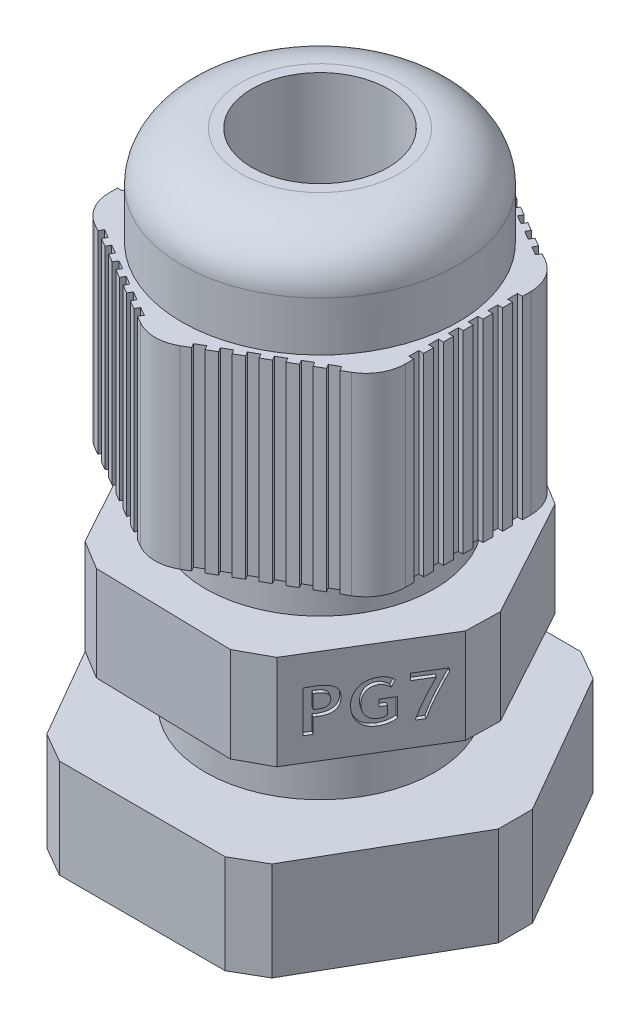
from build123d import *

# Parameters (mm, degrees)
SKETCH1_R           = 5.8
BOSS_EXTRUDE1_DEPTH = 8.25
BOSS_EXTRUDE2_DEPTH = 4.8
SKETCH3_R           = 5.8
BOSS_EXTRUDE3_DEPTH = 2.5
BOSS_EXTRUDE4_DEPTH = 9.8
CHAMFER1_SIZE       = 1
FILLET1_R           = 2
SKETCH5_R           = 7
BOSS_EXTRUDE5_DEPTH = 5
FILLET2_SIZE        = 2.5
FILLET2_SIZE_2      = 3
SKETCH6_R           = 3.45
CUT_EXTRUDE1_DEPTH  = 30.35
CUT_EXTRUDE2_DEPTH  = 0.2
SKETCH8_W           = 0.5
SKETCH8_H           = 9.8
CUT_EXTRUDE3_DEPTH  = 0.25
SKETCH10_R          = 5.8
BOSS_EXTRUDE7_DEPTH = 5
CIRPATTERN1_COUNT   = 6
CIRPATTERN2_COUNT   = 3


with BuildPart() as part:
    # Sketch1 → Boss-Extrude1 (new body)
    with BuildSketch(Plane(origin=(0, 0, 0), x_dir=(1, 0, 0), z_dir=(0, 1, 0))):
        with Locations(Location((0, 0, 0), (0, 0, 270))):
            Circle(SKETCH1_R)
    extrude(amount=BOSS_EXTRUDE1_DEPTH)

    # Sketch2 → Boss-Extrude2 (add)
    with BuildSketch(Plane(origin=(0, 8.25, 0), x_dir=(1, 0, 0), z_dir=(0, 1, 0))):
        Polygon((8.946496097, -0.208664632), (4.65395692, 7.643560578), (-4.292539176, 7.85222521), (-8.946496097, 0.208664632), (-4.65395692, -7.643560578), (4.292539176, -7.85222521), align=None)
    extrude(amount=BOSS_EXTRUDE2_DEPTH)

    # Sketch3 → Boss-Extrude3 (add)
    with BuildSketch(Plane(origin=(0, 13.05, 0), x_dir=(1, 0, 0), z_dir=(0, 1, 0))):
        with Locations(Location((0, 0, 0), (0, 0, 270))):
            Circle(SKETCH3_R)
    extrude(amount=BOSS_EXTRUDE3_DEPTH)

    # Sketch4 → Boss-Extrude4 (add)
    with BuildSketch(Plane(origin=(0, 15.55, 0), x_dir=(1, 0, 0), z_dir=(0, 1, 0))):
        Polygon((7.5, 4.330127019), (0, 8.660254038), (-7.5, 4.330127019), (-7.5, -4.330127019), (0, -8.660254038), (7.5, -4.330127019), align=None)
    extrude(amount=BOSS_EXTRUDE4_DEPTH)

    # Chamfer1
    chamfer1_edges = [part.edges().sort_by_distance(p)[0] for p in [
        (4.292539176, 10.65, 7.85222521),
        (8.946496097, 10.65, 0.208664632),
        (4.65395692, 10.65, -7.643560578),
        (-4.292539176, 10.65, -7.85222521),
        (-8.946496097, 10.65, -0.208664632),
        (-4.65395692, 10.65, 7.643560578),
    ]]
    chamfer(chamfer1_edges, length=CHAMFER1_SIZE)

    # Fillet1
    fillet1_edges = [part.edges().sort_by_distance(p)[0] for p in [
        (7.5, 20.45, 4.330127019),
        (7.5, 20.45, -4.330127019),
        (0, 20.45, -8.660254038),
        (-7.5, 20.45, -4.330127019),
        (-7.5, 20.45, 4.330127019),
        (0, 20.45, 8.660254038),
    ]]
    fillet(fillet1_edges, radius=FILLET1_R)

    # Sketch5 → Boss-Extrude5 (add)
    with BuildSketch(Plane(origin=(0, 25.35, 0), x_dir=(1, 0, 0), z_dir=(0, 1, 0))):
        with Locations(Location((0, 0, 0), (0, 0, 270))):
            Circle(SKETCH5_R)
    extrude(amount=BOSS_EXTRUDE5_DEPTH)

    # Fillet2
    # an asymmetric fillet: 3, 2.5 mm, written as the material it takes off along each edge
    with BuildSketch(Plane(origin=(0, 30.35, 0), x_dir=(0, 0, 1), z_dir=(-1, 0, 0))) as fillet2_piece_1:
        with BuildLine():
            Bezier((7, -FILLET2_SIZE), (7, 0), (7 - FILLET2_SIZE_2, 0), weights=[1, 0.707106781, 1])
            Line((7 - FILLET2_SIZE_2, 0), (7, 0))
            Line((7, 0), (7, -FILLET2_SIZE))
        make_face()
    revolve(axis=Axis((0, 30.35, 0), (0, 1, 0)), mode=Mode.SUBTRACT)

    # Sketch6 → Cut-Extrude1 (cut)
    with BuildSketch(Plane(origin=(0, 30.35, 0), x_dir=(1, 0, 0), z_dir=(0, 1, 0))):
        with Locations(Location((0, 0, 0), (0, 0, 270))):
            Circle(SKETCH6_R)
    extrude(amount=-CUT_EXTRUDE1_DEPTH, mode=Mode.SUBTRACT)

    # Sketch7 → Cut-Extrude2 (cut)
    # profile 1 of 3: a face of its own
    with BuildSketch(Plane(origin=(-6.800226508, 0, 3.717447973), x_dir=(0.4796707062222577, 0, 0.8774485817369816), z_dir=(-0.8774485817369816, 0, 0.4796707062222577))):
        with BuildLine():
            Line((-2.134885405, 10.216379947), (-2.134885405, 9.45))
            Line((-2.134885405, 9.45), (-2.513219528, 9.45))
            Line((-2.513219528, 9.45), (-2.513219528, 11.542238367))
            add(Edge.make_bspline(
                [(-2.513219528, 11.542238367), (-2.483523913, 11.543567356), (-2.427375364, 11.546080213), (-2.347967637, 11.548688603), (-2.27846118, 11.551957657), (-2.218632578, 11.553974035), (-2.168665192, 11.555578539), (-2.128279385, 11.557149828), (-2.097725351, 11.557314508), (-2.08055587, 11.55770478), (-2.073659459, 11.55786154)],
                knots=[0, 0, 0, 0, 1.621915894, 3.06672294, 4.33503342, 5.418568965, 6.332983946, 7.062930741, 7.623610357, 8, 8, 8, 8], degree=3))
            add(Edge.make_bspline(
                [(-2.073659459, 11.55786154), (-2.033253135, 11.557378437), (-1.95518837, 11.556445087), (-1.842316581, 11.549232733), (-1.737858336, 11.537617628), (-1.641731769, 11.521448641), (-1.553863318, 11.500074815), (-1.474521723, 11.473564124), (-1.403211823, 11.442992506), (-1.340418447, 11.406840154), (-1.285417521, 11.365570046), (-1.237401277, 11.319382527), (-1.197617084, 11.26710511), (-1.163991949, 11.210101824), (-1.138970637, 11.147036902), (-1.12063961, 11.078922791), (-1.110248523, 11.005456847), (-1.108749639, 10.954782697), (-1.107978502, 10.928712162)],
                knots=[0, 0, 0, 0, 1.477239666, 2.854017795, 4.133233606, 5.318502461, 6.415589596, 7.435923392, 8.373832858, 9.247662204, 10.078235651, 10.882486382, 11.675045235, 12.472932273, 13.294755343, 14.147339862, 15.04685446, 16, 16, 16, 16], degree=3))
            add(Edge.make_bspline(
                [(-1.107978502, 10.928712162), (-1.108573533, 10.899542636), (-1.109730059, 10.842847635), (-1.120185701, 10.760787184), (-1.13618153, 10.684080634), (-1.160129653, 10.61328312), (-1.189904379, 10.547710765), (-1.227062562, 10.488065605), (-1.270707731, 10.4339653), (-1.321709039, 10.385985109), (-1.378896899, 10.343043645), (-1.443115023, 10.306352429), (-1.513823244, 10.275484008), (-1.591060478, 10.250283457), (-1.674939167, 10.230432462), (-1.765622391, 10.216886085), (-1.86293348, 10.208306115), (-1.930076108, 10.207225702), (-1.9647195, 10.206668245)],
                knots=[0, 0, 0, 0, 1.091067431, 2.120640177, 3.090684274, 4.018396006, 4.911555342, 5.779703764, 6.64093865, 7.505260178, 8.393264397, 9.311130961, 10.266246865, 11.27557445, 12.347403441, 13.487847833, 14.703811947, 16, 16, 16, 16], degree=3))
            add(Edge.make_bspline(
                [(-1.9647195, 10.206668245), (-1.976123556, 10.206701924), (-2.000920231, 10.206775155), (-2.040735846, 10.209336139), (-2.086082113, 10.21207232), (-2.118001293, 10.214889669), (-2.134885405, 10.216379947)],
                knots=[0, 0, 0, 0, 0.802473668, 1.744877334, 2.807120216, 4, 4, 4, 4], degree=3))
        make_face()
        with BuildLine():
            Line((-2.134885405, 11.226396934), (-2.134885405, 10.541088585))
            add(Edge.make_bspline(
                [(-2.134885405, 10.541088585), (-2.119684957, 10.539683417), (-2.091123571, 10.53704313), (-2.050769504, 10.53327857), (-2.015540106, 10.531766425), (-1.993714297, 10.531209597), (-1.983720656, 10.530954636)],
                knots=[0, 0, 0, 0, 1.208754047, 2.271228472, 3.208426916, 4, 4, 4, 4], degree=3))
            add(Edge.make_bspline(
                [(-1.983720656, 10.530954636), (-1.962880278, 10.531135836), (-1.922560705, 10.531486401), (-1.864374221, 10.535910165), (-1.810433828, 10.542296714), (-1.761048697, 10.552316235), (-1.715568643, 10.563521662), (-1.674842164, 10.578994779), (-1.638315092, 10.596684303), (-1.605589771, 10.616857511), (-1.577622667, 10.641052235), (-1.552489017, 10.66758982), (-1.53250897, 10.698541535), (-1.51519604, 10.732191227), (-1.50224623, 10.769609665), (-1.493254671, 10.810290418), (-1.486924704, 10.854201041), (-1.486521703, 10.884633205), (-1.486312624, 10.900421552)],
                knots=[0, 0, 0, 0, 1.403595211, 2.715515055, 3.929222961, 5.059826169, 6.108541088, 7.08069188, 7.988175292, 8.840483437, 9.661193659, 10.47314836, 11.293639464, 12.13324769, 13.017905562, 13.951754922, 14.937360934, 16, 16, 16, 16], degree=3))
            add(Edge.make_bspline(
                [(-1.486312624, 10.900421552), (-1.48667261, 10.913965119), (-1.487370582, 10.940224546), (-1.494066128, 10.978134579), (-1.503859402, 11.013686705), (-1.519019714, 11.04628161), (-1.537603358, 11.076815354), (-1.561032375, 11.104213439), (-1.588583551, 11.128943766), (-1.619855059, 11.151475598), (-1.655744825, 11.170803974), (-1.695521578, 11.187589522), (-1.739433227, 11.201996391), (-1.787421917, 11.213745397), (-1.83983467, 11.222321087), (-1.896158474, 11.229216183), (-1.956789048, 11.23286888), (-1.99849506, 11.23333462), (-2.020033975, 11.233575149)],
                knots=[0, 0, 0, 0, 0.913750955, 1.771658647, 2.592923553, 3.396899075, 4.190866566, 5.000218413, 5.821208234, 6.686404457, 7.596737657, 8.567773798, 9.598787233, 10.714604217, 11.900680618, 13.183445848, 14.545401084, 16, 16, 16, 16], degree=3))
            add(Edge.make_bspline(
                [(-2.020033975, 11.233575149), (-2.0394783, 11.233344616), (-2.077884026, 11.232889277), (-2.116044894, 11.228542831), (-2.134885405, 11.226396934)],
                knots=[0, 0, 0, 0, 1.012574262, 2, 2, 2, 2], degree=3))
        make_face(mode=Mode.SUBTRACT)
    # profile 2 of 3: a face of its own
    with BuildSketch(Plane(origin=(-6.800226508, 0, 3.717447973), x_dir=(0.4796707062222577, 0, 0.8774485817369816), z_dir=(-0.8774485817369816, 0, 0.4796707062222577))):
        with BuildLine():
            Line((0.891787574, 11.341670612), (0.736400346, 11.043563592))
            add(Edge.make_bspline(
                [(0.736400346, 11.043563592), (0.724076867, 11.054375595), (0.697509418, 11.077684544), (0.650376761, 11.109333555), (0.594070525, 11.140270196), (0.53178361, 11.170870113), (0.467487444, 11.198270759), (0.405340879, 11.218223881), (0.348040675, 11.23111622), (0.311253795, 11.232786508), (0.293884542, 11.233575149)],
                knots=[0, 0, 0, 0, 0.803088321, 1.731330006, 2.775510355, 3.951250131, 5.13276654, 6.197670446, 7.149014066, 8, 8, 8, 8], degree=3))
            add(Edge.make_bspline(
                [(0.293884542, 11.233575149), (0.268516955, 11.232929848), (0.218996656, 11.23167015), (0.146871851, 11.221756719), (0.078924726, 11.205833067), (0.014985708, 11.183361622), (-0.044924973, 11.154189176), (-0.100354598, 11.117950684), (-0.152063557, 11.075802101), (-0.1990169, 11.027314535), (-0.241340233, 10.973562986), (-0.278332239, 10.915067323), (-0.30893569, 10.851866097), (-0.334584632, 10.784528593), (-0.354272188, 10.712832218), (-0.368057371, 10.636664225), (-0.376661638, 10.556205217), (-0.377767163, 10.500997323), (-0.378334122, 10.472684425)],
                knots=[0, 0, 0, 0, 1.061607425, 2.072373566, 3.041316938, 3.978664007, 4.903577062, 5.82367322, 6.744825227, 7.690652244, 8.643063079, 9.60425442, 10.581865327, 11.577666068, 12.616882387, 13.689323984, 14.814989508, 16, 16, 16, 16], degree=3))
            add(Edge.make_bspline(
                [(-0.378334122, 10.472684425), (-0.377962667, 10.445773892), (-0.377239168, 10.393359162), (-0.368277431, 10.31690348), (-0.355159316, 10.244511191), (-0.33600237, 10.176132357), (-0.311761697, 10.111780412), (-0.281329353, 10.051903583), (-0.246408437, 9.995639321), (-0.205324345, 9.94434383), (-0.159961614, 9.897847329), (-0.110255241, 9.857421608), (-0.056507594, 9.82335115), (0.001011436, 9.795469319), (0.062633939, 9.773731709), (0.128022503, 9.758317236), (0.197469442, 9.748738382), (0.24501259, 9.747762822), (0.269394163, 9.747262525)],
                knots=[0, 0, 0, 0, 1.175642092, 2.289845553, 3.36012681, 4.388586818, 5.389480953, 6.360704106, 7.319987344, 8.278875946, 9.227266791, 10.15446886, 11.072687671, 12.002702105, 12.942533815, 13.922910871, 14.934805516, 16, 16, 16, 16], degree=3))
            add(Edge.make_bspline(
                [(0.269394163, 9.747262525), (0.285453965, 9.747571972), (0.316952465, 9.748178899), (0.363116766, 9.75338429), (0.407218275, 9.761695109), (0.44906008, 9.773728909), (0.489088613, 9.788116013), (0.526275913, 9.807312362), (0.562208552, 9.828328595), (0.583747872, 9.845781133), (0.59452505, 9.854513493)],
                knots=[0, 0, 0, 0, 1.102277998, 2.161926074, 3.18530887, 4.179487772, 5.148746423, 6.099475529, 7.049074482, 8, 8, 8, 8], degree=3))
            Line((0.59452505, 9.854513493), (0.59452505, 10.260715977))
            Line((0.59452505, 10.260715977), (0.297262525, 10.260715977))
            Line((0.297262525, 10.260715977), (0.297262525, 10.585002367))
            Line((0.297262525, 10.585002367), (0.972859172, 10.585002367))
            Line((0.972859172, 10.585002367), (0.972859172, 9.651834498))
            add(Edge.make_bspline(
                [(0.972859172, 9.651834498), (0.949599291, 9.634226486), (0.901743675, 9.597999204), (0.82024986, 9.553364669), (0.729631307, 9.514513393), (0.631328024, 9.482030262), (0.528658008, 9.455498456), (0.42456813, 9.437256854), (0.320771845, 9.425142485), (0.251552376, 9.423696959), (0.217035423, 9.422976134)],
                knots=[0, 0, 0, 0, 0.870664705, 1.79133311, 2.767049987, 3.813635233, 4.88153103, 5.932458395, 6.969000538, 8, 8, 8, 8], degree=3))
            add(Edge.make_bspline(
                [(0.217035423, 9.422976134), (0.180537752, 9.423851812), (0.109392973, 9.425558768), (0.00544294, 9.439351085), (-0.09262477, 9.461929835), (-0.185113491, 9.493775994), (-0.271730421, 9.534656426), (-0.352071975, 9.585706065), (-0.427185267, 9.644742349), (-0.495465696, 9.713105553), (-0.557075086, 9.788378839), (-0.610437262, 9.870485274), (-0.655973851, 9.958225017), (-0.692353632, 10.052129016), (-0.722079541, 10.151385747), (-0.741676485, 10.256857234), (-0.754330965, 10.367939725), (-0.755877139, 10.443935067), (-0.756668245, 10.482818375)],
                knots=[0, 0, 0, 0, 1.078523268, 2.102361525, 3.093383046, 4.048598645, 4.988386713, 5.917589169, 6.856492748, 7.806721191, 8.767744943, 9.72667712, 10.696138106, 11.684273533, 12.699256925, 13.754277165, 14.850967335, 16, 16, 16, 16], degree=3))
            add(Edge.make_bspline(
                [(-0.756668245, 10.482818375), (-0.755785722, 10.521706102), (-0.754056713, 10.597893563), (-0.740225399, 10.709366005), (-0.718065346, 10.815265476), (-0.686809667, 10.915651344), (-0.646045848, 11.010246675), (-0.596395164, 11.099377003), (-0.537945532, 11.183092316), (-0.470291249, 11.260116192), (-0.395492528, 11.330066869), (-0.314036735, 11.391494201), (-0.225792216, 11.442647028), (-0.131717204, 11.485303516), (-0.030986256, 11.517462249), (0.075500997, 11.541306755), (0.188370696, 11.555317669), (0.265695409, 11.557000129), (0.305285235, 11.55786154)],
                knots=[0, 0, 0, 0, 1.09580876, 2.146869803, 3.160705443, 4.141905076, 5.105078571, 6.058760661, 7.012970696, 7.977319969, 8.942900637, 9.895021932, 10.846233649, 11.812172839, 12.800771104, 13.821013303, 14.884370835, 16, 16, 16, 16], degree=3))
            add(Edge.make_bspline(
                [(0.305285235, 11.55786154), (0.333466334, 11.557231877), (0.389029752, 11.555990401), (0.470702702, 11.545589003), (0.549173164, 11.528822356), (0.624359871, 11.504992235), (0.696408779, 11.474611005), (0.765112009, 11.437047884), (0.831028972, 11.393326838), (0.871423711, 11.358983721), (0.891787574, 11.341670612)],
                knots=[0, 0, 0, 0, 1.05697557, 2.0839917, 3.08348732, 4.063827804, 5.038734547, 6.012267375, 6.997940923, 8, 8, 8, 8], degree=3))
        make_face()
    # profile 3 of 3: a face of its own
    with BuildSketch(Plane(origin=(-6.800226508, 0, 3.717447973), x_dir=(0.4796707062222577, 0, 0.8774485817369816), z_dir=(-0.8774485817369816, 0, 0.4796707062222577))):
        with BuildLine():
            Line((2.026789942, 9.45), (1.621431953, 9.45))
            add(Edge.make_bspline(
                [(1.621431953, 9.45), (1.631360844, 9.480282312), (1.65153799, 9.541820972), (1.683529259, 9.635284466), (1.718698784, 9.731056194), (1.756403757, 9.829344176), (1.795901128, 9.930459866), (1.838724889, 10.033793693), (1.883876724, 10.139797153), (1.931626534, 10.248307368), (1.981878847, 10.359363723), (2.034716889, 10.472927695), (2.089924766, 10.589173193), (2.148396997, 10.707594294), (2.208690896, 10.828895344), (2.271562202, 10.952716252), (2.337556848, 11.078762412), (2.382434195, 11.163638271), (2.405124064, 11.206551283)],
                knots=[0, 0, 0, 0, 0.794260991, 1.61406953, 2.461925064, 3.33686576, 4.23777069, 5.167373618, 6.124525522, 7.109355414, 8.121981726, 9.162513398, 10.231050836, 11.329228568, 12.454048731, 13.607132615, 14.79017254, 16, 16, 16, 16], degree=3))
            Line((2.405124064, 11.206551283), (1.459288758, 11.206551283))
            Line((1.459288758, 11.206551283), (1.459288758, 11.530837674))
            Line((1.459288758, 11.530837674), (2.89155365, 11.530837674))
            Line((2.89155365, 11.530837674), (2.89155365, 11.373761453))
            Line((2.89155365, 11.373761453), (2.705764572, 11.021606701))
            add(Edge.make_bspline(
                [(2.705764572, 11.021606701), (2.690239491, 10.991226529), (2.658530957, 10.929177851), (2.610881434, 10.833923831), (2.562290351, 10.734289605), (2.495180097, 10.595899752), (2.411728897, 10.418277354), (2.331492889, 10.238637866), (2.269561135, 10.095666396), (2.225565743, 9.991880872), (2.184534054, 9.891402365), (2.146873492, 9.794568837), (2.11137206, 9.702215557), (2.080584719, 9.613969468), (2.051786413, 9.530709166), (2.034955596, 9.476365447), (2.026789942, 9.45)],
                knots=[0, 0, 0, 0, 0.836079797, 1.707615262, 2.610034499, 3.552607617, 5.476750089, 7.419053175, 8.373784903, 9.29500588, 10.181483737, 11.033379653, 11.841190972, 12.605931847, 13.323652654, 14, 14, 14, 14], degree=3))
        make_face()
    cut_extrude2 = extrude(amount=-CUT_EXTRUDE2_DEPTH, mode=Mode.SUBTRACT)

    # Sketch8 → Cut-Extrude3 (cut)
    with BuildSketch(Plane(origin=(7.5, 0, 0), x_dir=(0, 0, -1), z_dir=(1, 0, 0))):
        with Locations((0.5, 20.45)):
            Rectangle(SKETCH8_W, SKETCH8_H)
        with Locations((-0.5, 20.45)):
            Rectangle(SKETCH8_W, SKETCH8_H)
        with Locations((1.5, 20.45)):
            Rectangle(SKETCH8_W, SKETCH8_H)
        with Locations((2.5, 20.45)):
            Rectangle(SKETCH8_W, SKETCH8_H)
        with Locations((-1.5, 20.45)):
            Rectangle(SKETCH8_W, SKETCH8_H)
        with Locations((-2.5, 20.45)):
            Rectangle(SKETCH8_W, SKETCH8_H)
    cut_extrude3 = extrude(amount=-CUT_EXTRUDE3_DEPTH, mode=Mode.SUBTRACT)

    # Sketch10 → Boss-Extrude7 (add)
    with BuildSketch(Plane.XZ):
        Polygon((-4.196152423, 9), (-5.696152423, 8.133974596), (-9.892304845, 0.866025404), (-9.892304845, -0.866025404), (-5.696152423, -8.133974596), (-4.196152423, -9), (4.196152423, -9), (5.696152423, -8.133974596), (9.892304845, -0.866025404), (9.892304845, 0.866025404), (5.696152423, 8.133974596), (4.196152423, 9), align=None)
        with Locations(Location((0, 0, 0), (0, 0, 270))):
            Circle(SKETCH10_R, mode=Mode.SUBTRACT)
    extrude(amount=-BOSS_EXTRUDE7_DEPTH)

    # CirPattern1: Cut-Extrude3 ×6 about axis
    cirpattern1_axis = Axis((0, 0, 0), (0, 1, 0))
    for i in range(1, CIRPATTERN1_COUNT):
        add(cut_extrude3.rotate(cirpattern1_axis, i * 360 / CIRPATTERN1_COUNT), mode=Mode.SUBTRACT)

    # CirPattern2: Cut-Extrude2 ×3 about axis
    cirpattern2_axis = Axis((0, 13.05, 0), (0, 1, 0))
    for i in range(1, CIRPATTERN2_COUNT):
        add(cut_extrude2.rotate(cirpattern2_axis, i * 360 / CIRPATTERN2_COUNT), mode=Mode.SUBTRACT)


solid = part.part
